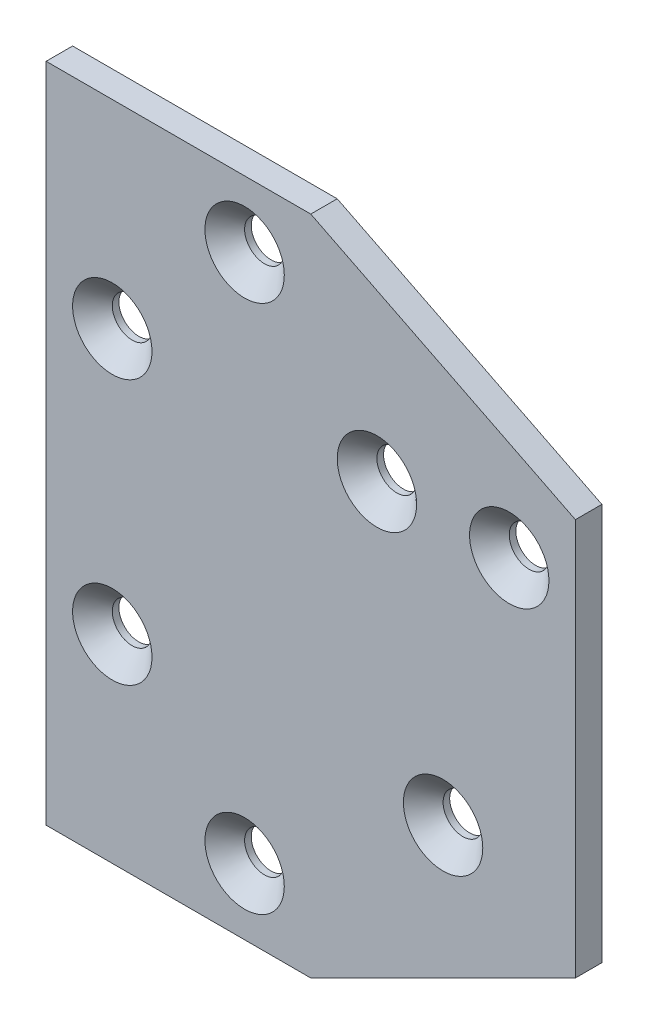
from build123d import *

# Parameters (mm, degrees)
BOSS_EXTRUDE1_DEPTH = 2
SKETCH2_R           = 3
CUT_EXTRUDE1_DEPTH  = 79.204859184
CHAMFER1_SIZE       = 3


with BuildPart() as part:
    # Sketch1 → Boss-Extrude1 (new, symmetric)
    with BuildSketch(Plane.XY):
        Polygon((-20, -50), (20, -50), (60, -30), (60, 30), (20, 50), (-20, 50), align=None)
    extrude(amount=BOSS_EXTRUDE1_DEPTH, both=True)

    # Sketch2 → Cut-Extrude1 (cut, through all)
    with BuildSketch(Plane.XY.offset(2)):
        with Locations((-10, 20)):
            Circle(SKETCH2_R)
        with Locations((-10, -20)):
            Circle(SKETCH2_R)
        with Locations((10, -40)):
            Circle(SKETCH2_R)
        with Locations((40, -20)):
            Circle(SKETCH2_R)
        with Locations((30, 20)):
            Circle(SKETCH2_R)
        with Locations((50, 20)):
            Circle(SKETCH2_R)
        with Locations((10, 40)):
            Circle(SKETCH2_R)
    extrude(amount=-CUT_EXTRUDE1_DEPTH, mode=Mode.SUBTRACT)

    # Chamfer1
    chamfer1_edges = [part.edges().sort_by_distance(p)[0] for p in [
        (7, -40, 2),
        (37, -20, 2),
        (-13, -20, 2),
        (47, 20, 2),
        (27, 20, 2),
        (7, 40, 2),
        (-13, 20, 2),
    ]]
    chamfer(chamfer1_edges, length=CHAMFER1_SIZE)


solid = part.part
